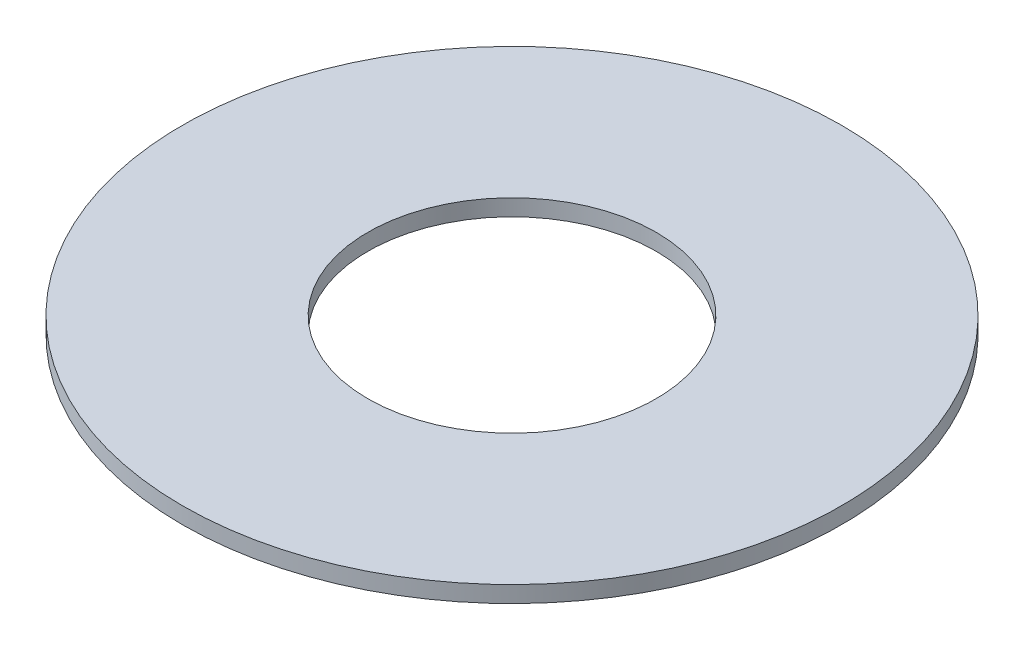
from build123d import *

# Parameters (mm, degrees)
SKETCH1_R           = 80
BOSS_EXTRUDE1_DEPTH = 4
SKETCH2_R           = 35
CUT_EXTRUDE1_DEPTH  = 114.207773585


with BuildPart() as part:
    # Sketch1 → Boss-Extrude1 (new body)
    with BuildSketch(Plane(origin=(0, 0, 0), x_dir=(1, 0, 0), z_dir=(0, 1, 0))):
        Circle(SKETCH1_R)
    extrude(amount=BOSS_EXTRUDE1_DEPTH)

    # Sketch2 → Cut-Extrude1 (cut, through all)
    with BuildSketch(Plane(origin=(0, 0, 0), x_dir=(1, 0, 0), z_dir=(0, 1, 0))):
        Circle(SKETCH2_R)
    extrude(amount=CUT_EXTRUDE1_DEPTH, mode=Mode.SUBTRACT)


solid = part.part
